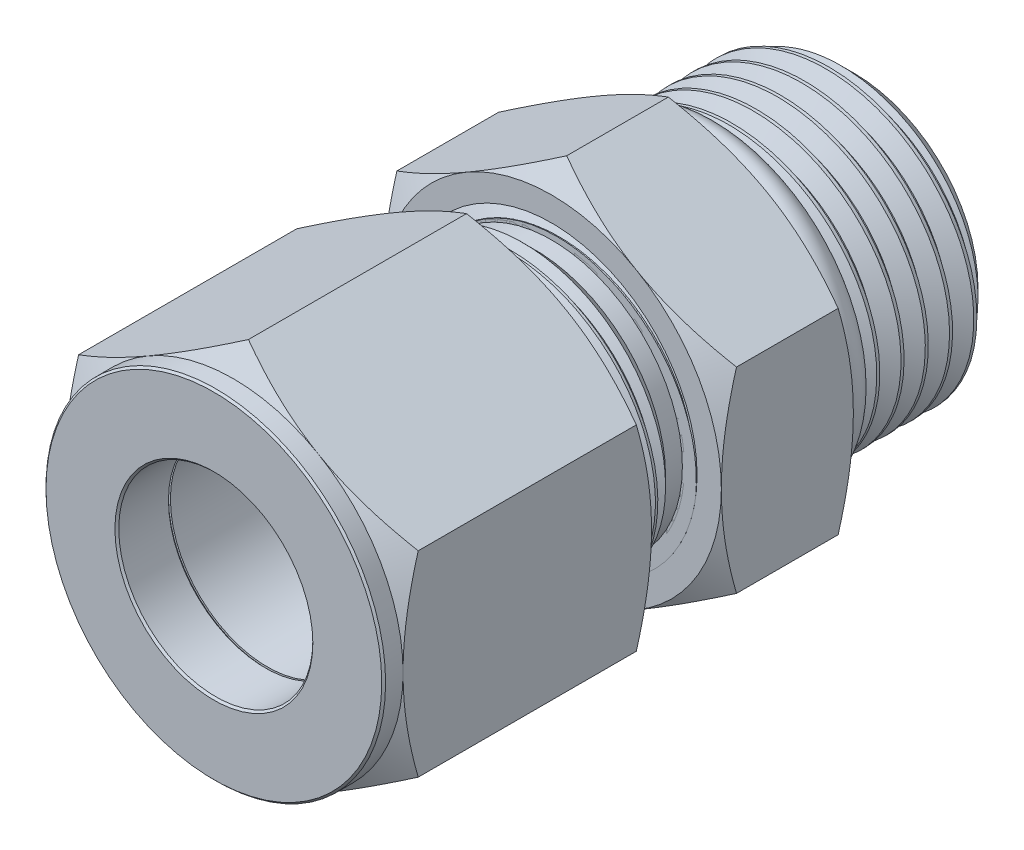
from build123d import *

# Parameters (mm, degrees)
BOSS_EXTRUDE1_DEPTH = 17.526
CHAMFER1_SIZE       = 0.127
SKETCH4_W           = 20.574
SKETCH4_H           = 9.525
BOSS_EXTRUDE2_DEPTH = 8.636
SKETCH11_W          = 11.176
SKETCH11_H          = 9.525
SKETCH15_R          = 1.1049
SKETCH17_OUTSIDE_W  = 160.102
SKETCH17_OUTSIDE_H  = 163.54
SKETCH17_OUTSIDE_R  = 11.1125
CUT_EXTRUDE1_DEPTH  = 36.110064377
CUT_EXTRUDE1_DRAFT  = -60
SKETCH18_OUTSIDE_W  = 135.004
SKETCH18_OUTSIDE_H  = 138.442
SKETCH18_OUTSIDE_R  = 11.1125
CUT_EXTRUDE2_DEPTH  = 28.865022314
CUT_EXTRUDE2_DRAFT  = -60
CHAMFER2_SIZE       = 1.42875
CUT_SWEEP1_PITCH    = 1.27
CUT_SWEEP2_PITCH    = 1.5875
SKETCH19_W          = 8.636
SKETCH19_H          = 0.824889197


with BuildPart() as part:
    # Sketch2 → Boss-Extrude1 (new body)
    with BuildSketch(Plane.XY):
        Polygon((0, 12.831609733), (-11.1125, 6.415804866), (-11.1125, -6.415804866), (0, -12.831609733), (11.1125, -6.415804866), (11.1125, 6.415804866), align=None)
    extrude(amount=-BOSS_EXTRUDE1_DEPTH)

    # Sketch3 → Cut-Revolve1 (revolve, cut)
    with BuildSketch(Plane(origin=(0, 0, 0), x_dir=(0, 0, -1), z_dir=(1, 0, 0)), mode=Mode.PRIVATE) as cut_revolve1_sk:
        Polygon((0, 12.831609733), (0, 11.1125), (1.27, 11.1125), (2.262528467, 12.831609733), (16.533471533, 12.831609733), (17.526, 11.1125), (17.526, 12.831609733), (17.526, 14.550719465), (0, 14.550719465), align=None)
        Polygon((0, 6.35), (0, 0), (17.526, 0), (17.526, 9.525), (7.0104, 9.525), (7.0104, 8.89), (3.5052, 8.89), (3.5052, 8.255), (3.5052, 6.35), align=None)
    revolve(cut_revolve1_sk.sketch.rotate(Axis((0, 0, 0), (0, 0, -1)), 90), axis=Axis((0, 0, 0), (0, 0, -1)), mode=Mode.SUBTRACT)

    # Chamfer1
    chamfer1_edges = [part.edges().sort_by_distance(p)[0] for p in [
        (-11.1125, 0, 0),
        (-6.35, 0, -3.5052),
        (-6.35, 0, 0),
    ]]
    chamfer(chamfer1_edges, length=CHAMFER1_SIZE)


with BuildPart() as body_2:
    # Sketch4 → Revolve1 (revolve)
    with BuildSketch(Plane(origin=(0, 0, 0), x_dir=(0, 0, -1), z_dir=(1, 0, 0)), mode=Mode.PRIVATE) as revolve1_sk:
        with Locations((20.447, 4.7625)):
            Rectangle(SKETCH4_W, SKETCH4_H)
    revolve(revolve1_sk.sketch.rotate(Axis((0, 0, -30.734), (0, 0, 1)), 90), axis=Axis((0, 0, -30.734), (0, 0, 1)))


with BuildPart() as body_3:
    # Sketch7 → Boss-Extrude2 (new body)
    with BuildSketch(Plane(origin=(0, 0, -30.734), x_dir=(-1, 0, 0), z_dir=(0, 0, -1))):
        Polygon((0, 12.831609733), (-11.1125, 6.415804866), (-11.1125, -6.415804866), (0, -12.831609733), (11.1125, -6.415804866), (11.1125, 6.415804866), align=None)
    extrude(amount=-BOSS_EXTRUDE2_DEPTH)


with BuildPart() as body_4:
    # Sketch9 → Revolve2 (revolve)
    with BuildSketch(Plane(origin=(0, 0, 0), x_dir=(0, 0, -1), z_dir=(1, 0, 0)), mode=Mode.PRIVATE) as revolve2_sk:
        Polygon((6.1976, 8.6614), (6.1976, 7.4676), (7.3152, 6.35), (13.5128, 6.35), (13.5128, 6.8834), align=None)
    revolve(revolve2_sk.sketch.rotate(Axis((0, 0, 0), (0, 0, -1)), 90), axis=Axis((0, 0, 0), (0, 0, -1)))


with BuildPart() as body_5:
    # Sketch10 → Revolve3 (revolve)
    with BuildSketch(Plane(origin=(0, 0, 0), x_dir=(0, 0, -1), z_dir=(1, 0, 0)), mode=Mode.PRIVATE) as revolve3_sk:
        Polygon((3.5052, 7.8359), (4.7752, 7.8359), (4.7752, 7.4676), (6.1976, 7.4676), (7.3152, 6.35), (3.5052, 6.35), align=None)
    revolve(revolve3_sk.sketch.rotate(Axis((0, 0, 0), (0, 0, -1)), 90), axis=Axis((0, 0, 0), (0, 0, -1)))


with BuildPart() as body_6:
    # Sketch11 → Revolve4 (revolve)
    with BuildSketch(Plane(origin=(0, 0, 0), x_dir=(0, 0, -1), z_dir=(1, 0, 0)), mode=Mode.PRIVATE) as revolve4_sk:
        with Locations((36.322, 4.7625)):
            Rectangle(SKETCH11_W, SKETCH11_H)
    revolve(revolve4_sk.sketch.rotate(Axis((0, 0, -30.734), (0, 0, -1)), 90), axis=Axis((0, 0, -30.734), (0, 0, -1)))


with BuildPart() as body_7:
    # Sketch15 → Revolve5 (revolve)
    with BuildSketch(Plane(origin=(0, 0, 0), x_dir=(0, 0, -1), z_dir=(1, 0, 0)), mode=Mode.PRIVATE) as revolve5_sk:
        with Locations((31.8389, 9.2837)):
            Circle(SKETCH15_R)
    revolve(revolve5_sk.sketch.rotate(Axis((0, 0, 0), (0, 0, -1)), 270), axis=Axis((0, 0, 0), (0, 0, -1)))


with BuildPart() as cut_extrude1_tool:
    # Sketch17 outside → Cut-Extrude1 (with draft: the straight prism first)
    with BuildSketch(Plane(origin=(0, 0, -30.734), x_dir=(-1, 0, 0), z_dir=(0, 0, -1))):
        Rectangle(SKETCH17_OUTSIDE_W, SKETCH17_OUTSIDE_H)
        with Locations(Location((0, 0, 0), (0, 0, 180))):
            Circle(SKETCH17_OUTSIDE_R, mode=Mode.SUBTRACT)
    extrude(amount=-CUT_EXTRUDE1_DEPTH)
    # Cut-Extrude1: the draft: its side faces are tilted about the plane it starts from
    cut_extrude1_sides = [cut_extrude1_tool.faces().sort_by_distance(p)[0] for p in [
        (0, -81.77, -12.678967811),
        (-80.051, 0, -12.678967811),
        (0, 81.77, -12.678967811),
        (80.051, 0, -12.678967811),
        (-11.1125, 0, -12.678967811),
    ]]
    draft(cut_extrude1_sides, Plane(origin=(0, 0, -30.734), x_dir=(-1, 0, 0), z_dir=(0, 0, -1)), CUT_EXTRUDE1_DRAFT)


with BuildPart() as body_3_1:
    add(body_3.part)

    # Cut-Extrude1: cut by cut_extrude1_tool
    add(cut_extrude1_tool.part, mode=Mode.SUBTRACT)


with BuildPart() as cut_extrude2_tool:
    # Sketch18 outside → Cut-Extrude2 (with draft: the straight prism first)
    with BuildSketch(Plane.XY.offset(-22.098)):
        Rectangle(SKETCH18_OUTSIDE_W, SKETCH18_OUTSIDE_H)
        Circle(SKETCH18_OUTSIDE_R, mode=Mode.SUBTRACT)
    extrude(amount=-CUT_EXTRUDE2_DEPTH)
    # Cut-Extrude2: the draft: its side faces are tilted about the plane it starts from
    cut_extrude2_sides = [cut_extrude2_tool.faces().sort_by_distance(p)[0] for p in [
        (0, -69.221, -36.530511157),
        (67.502, 0, -36.530511157),
        (0, 69.221, -36.530511157),
        (-67.502, 0, -36.530511157),
        (-11.1125, 0, -36.530511157),
    ]]
    draft(cut_extrude2_sides, Plane.XY.offset(-22.098), CUT_EXTRUDE2_DRAFT)


with BuildPart() as body_3_2:
    add(body_3_1.part)

    # Cut-Extrude2: cut by cut_extrude2_tool
    add(cut_extrude2_tool.part, mode=Mode.SUBTRACT)


with BuildPart() as cut_revolve5_tool:
    # Sketch16 → Cut-Revolve5 (revolve)
    with BuildSketch(Plane(origin=(0, 0, 0), x_dir=(0, 0, -1), z_dir=(1, 0, 0))):
        Polygon((41.91, 0), (10.16, 0), (10.16, 7.698316667), (15.70736, 6.35), (22.86, 6.35), (22.86, 5.1562), (41.91, 5.1562), (43.4975, 5.1562), (43.4975, 0), align=None)
    revolve(axis=Axis((0, 0, -41.91), (0, 0, 1)))


with BuildPart() as body_3_3:
    add(body_3_2.part)

    # Cut-Revolve5: cut by cut_revolve5_tool
    add(cut_revolve5_tool.part, mode=Mode.SUBTRACT)

    # Sketch19 → Cut-Revolve7 (revolve, cut)
    with BuildSketch(Plane(origin=(0, 0, 0), x_dir=(0, 0, -1), z_dir=(1, 0, 0)), mode=Mode.PRIVATE) as cut_revolve7_sk:
        with Locations((26.416, 9.112555401)):
            Rectangle(SKETCH19_W, SKETCH19_H)
    revolve(cut_revolve7_sk.sketch.rotate(Axis((0, 0, 0), (0, 0, -1)), 90), axis=Axis((0, 0, 0), (0, 0, -1)), mode=Mode.SUBTRACT)


with BuildPart() as body_2_1:
    add(body_2.part)

    # Cut-Revolve5: cut by cut_revolve5_tool
    add(cut_revolve5_tool.part, mode=Mode.SUBTRACT)

    # Cut-Sweep1: the profile of Sketch6 screwed along a right-hand helix of 17.2 turns, 8 arcs to a turn; built about Z, then put on its axis
    cut_sweep1_z = Axis((0, 0, 0), (0, 0, 1))
    cut_sweep1_corners = [(8.700110803, 0, -0.635), (9.593740766, 0, -1.1509375), (9.593740766, 0, 0.0396875), (8.700110803, 0, -0.47625)]
    with BuildLine(mode=Mode.PRIVATE) as cut_sweep1_profile:
        Line(cut_sweep1_corners[0], cut_sweep1_corners[1])
        Line(cut_sweep1_corners[1], cut_sweep1_corners[2])
        Line(cut_sweep1_corners[2], cut_sweep1_corners[3])
        Line(cut_sweep1_corners[3], cut_sweep1_corners[0])
    cut_sweep1_cap = Face(cut_sweep1_profile.wire())
    cut_sweep1_turn_angles = [0, 22.5, 45, 67.5, 90, 112.5, 135, 157.5, 180, 202.5, 225, 247.5, 270, 292.5, 315, 337.5, 360]
    cut_sweep1_turn_weights = [1, 0.9238795325112867, 1, 0.9238795325112867, 1, 0.9238795325112867, 1, 0.9238795325112867, 1, 0.9238795325112867, 1, 0.9238795325112867, 1, 0.9238795325112867, 1, 0.9238795325112867, 1]
    cut_sweep1_turn_rails = [Edge.make_bspline([Vector(p[0], p[1], 0).rotate(cut_sweep1_z, cut_sweep1_turn_angles[k]) / cut_sweep1_turn_weights[k] + Vector(0, 0, p[2] + CUT_SWEEP1_PITCH * cut_sweep1_turn_angles[k] / 360) for k in range(17)], [0, 0, 0, 1, 1, 2, 2, 3, 3, 4, 4, 5, 5, 6, 6, 7, 7, 8, 8, 8], 2, cut_sweep1_turn_weights) for p in cut_sweep1_corners]
    cut_sweep1_turn_sides = [Face.make_surface_from_curves(cut_sweep1_turn_rails[p[0]], cut_sweep1_turn_rails[p[1]]) for p in [(0, 1), (1, 2), (2, 3), (3, 0)]]
    cut_sweep1_last_angles = [6120, 6142.5, 6165, 6178.5, 6192]
    cut_sweep1_last_weights = [1, 0.9238795325112867, 1, 0.9723699203977044, 1]
    cut_sweep1_last_rails = [Edge.make_bspline([Vector(p[0], p[1], 0).rotate(cut_sweep1_z, cut_sweep1_last_angles[k]) / cut_sweep1_last_weights[k] + Vector(0, 0, p[2] + CUT_SWEEP1_PITCH * cut_sweep1_last_angles[k] / 360) for k in range(5)], [0, 0, 0, 1, 1, 2, 2, 2], 2, cut_sweep1_last_weights) for p in cut_sweep1_corners]
    cut_sweep1_last_sides = [Face.make_surface_from_curves(cut_sweep1_last_rails[p[0]], cut_sweep1_last_rails[p[1]]) for p in [(0, 1), (1, 2), (2, 3), (3, 0)]]
    cut_sweep1 = Plane(origin=(0, 0, -10.16), x_dir=(0, 1, 0), z_dir=(0, 0, -1)) * Solid(Shell([*[p.moved(Location((0, 0, CUT_SWEEP1_PITCH * i))) for i in range(17) for p in cut_sweep1_turn_sides], *cut_sweep1_last_sides, cut_sweep1_cap, cut_sweep1_cap.rotate(cut_sweep1_z, 6192).moved(Location((0, 0, CUT_SWEEP1_PITCH * 6192 / 360)))]))
    add(cut_sweep1, mode=Mode.SUBTRACT)

    # Sketch8 → Cut-Revolve2 (revolve, cut)
    with BuildSketch(Plane(origin=(0, 0, 0), x_dir=(0, 0, -1), z_dir=(1, 0, 0)), mode=Mode.PRIVATE) as cut_revolve2_sk:
        Polygon((10.16, 9.662481533), (10.16, 8.56262927), (11.259852263, 9.662481533), align=None)
        Polygon((22.098, 9.662481533), (19.898295474, 9.662481533), (20.998147737, 8.56262927), (22.098, 8.56262927), align=None)
    revolve(cut_revolve2_sk.sketch.rotate(Axis((0, 0, 0), (0, 0, -1)), 90), axis=Axis((0, 0, 0), (0, 0, -1)), mode=Mode.SUBTRACT)


with BuildPart() as body_6_1:
    add(body_6.part)

    # Cut-Revolve5: cut by cut_revolve5_tool
    add(cut_revolve5_tool.part, mode=Mode.SUBTRACT)

    # Chamfer2
    chamfer2_edges = [body_6_1.edges().sort_by_distance(p)[0] for p in [
        (-9.525, 0, -41.91),
    ]]
    chamfer(chamfer2_edges, length=CHAMFER2_SIZE)

    # Cut-Sweep2: the profile of Sketch13 screwed along a right-hand helix of 8.04 turns, 8 arcs to a turn; built about Z, then put on its axis
    cut_sweep2_z = Axis((0, 0, 0), (0, 0, 1))
    cut_sweep2_corners = [(9.696851916, 0, 0.09921875), (9.610925958, 0, -1.438671875), (8.493888504, 0, -0.79375), (8.493888504, 0, -0.5953125)]
    with BuildLine(mode=Mode.PRIVATE) as cut_sweep2_profile:
        Line(cut_sweep2_corners[0], cut_sweep2_corners[1])
        Line(cut_sweep2_corners[1], cut_sweep2_corners[2])
        Line(cut_sweep2_corners[2], cut_sweep2_corners[3])
        Line(cut_sweep2_corners[3], cut_sweep2_corners[0])
    cut_sweep2_cap = Face(cut_sweep2_profile.wire())
    cut_sweep2_turn_angles = [0, 22.5, 45, 67.5, 90, 112.5, 135, 157.5, 180, 202.5, 225, 247.5, 270, 292.5, 315, 337.5, 360]
    cut_sweep2_turn_weights = [1, 0.9238795325112867, 1, 0.9238795325112867, 1, 0.9238795325112867, 1, 0.9238795325112867, 1, 0.9238795325112867, 1, 0.9238795325112867, 1, 0.9238795325112867, 1, 0.9238795325112867, 1]
    cut_sweep2_turn_rails = [Edge.make_bspline([Vector(p[0], p[1], 0).rotate(cut_sweep2_z, cut_sweep2_turn_angles[k]) / cut_sweep2_turn_weights[k] + Vector(0, 0, p[2] + CUT_SWEEP2_PITCH * cut_sweep2_turn_angles[k] / 360) for k in range(17)], [0, 0, 0, 1, 1, 2, 2, 3, 3, 4, 4, 5, 5, 6, 6, 7, 7, 8, 8, 8], 2, cut_sweep2_turn_weights) for p in cut_sweep2_corners]
    cut_sweep2_turn_sides = [Face.make_surface_from_curves(cut_sweep2_turn_rails[p[0]], cut_sweep2_turn_rails[p[1]]) for p in [(0, 1), (1, 2), (2, 3), (3, 0)]]
    cut_sweep2_last_angles = [2880, 2887.2, 2894.4]
    cut_sweep2_last_weights = [1, 0.9921147013144598, 1]
    cut_sweep2_last_rails = [Edge.make_bspline([Vector(p[0], p[1], 0).rotate(cut_sweep2_z, cut_sweep2_last_angles[k]) / cut_sweep2_last_weights[k] + Vector(0, 0, p[2] + CUT_SWEEP2_PITCH * cut_sweep2_last_angles[k] / 360) for k in range(3)], [0, 0, 0, 1, 1, 1], 2, cut_sweep2_last_weights) for p in cut_sweep2_corners]
    cut_sweep2_last_sides = [Face.make_surface_from_curves(cut_sweep2_last_rails[p[0]], cut_sweep2_last_rails[p[1]]) for p in [(0, 1), (1, 2), (2, 3), (3, 0)]]
    cut_sweep2 = Plane(origin=(0, 0, -43.18), x_dir=(0, 1, 0), z_dir=(0, 0, 1)) * Solid(Shell([*[p.moved(Location((0, 0, CUT_SWEEP2_PITCH * i))) for i in range(8) for p in cut_sweep2_turn_sides], *cut_sweep2_last_sides, cut_sweep2_cap, cut_sweep2_cap.rotate(cut_sweep2_z, 2894.4).moved(Location((0, 0, CUT_SWEEP2_PITCH * 2894.4 / 360)))]))
    add(cut_sweep2, mode=Mode.SUBTRACT)

    # Sketch14 → Cut-Revolve4 (revolve, cut)
    with BuildSketch(Plane(origin=(0, 0, 0), x_dir=(0, 0, -1), z_dir=(1, 0, 0)), mode=Mode.PRIVATE) as cut_revolve4_sk:
        Polygon((33.483630657, 9.696851916), (30.734, 9.696851916), (30.734, 8.322036588), (32.108815329, 8.322036588), align=None)
    revolve(cut_revolve4_sk.sketch.rotate(Axis((0, 0, 0), (0, 0, -1)), 273.48162949), axis=Axis((0, 0, 0), (0, 0, -1)), mode=Mode.SUBTRACT)


with BuildPart() as part_1:
    add(part.part)

    # Combine3: union body 5, body 4
    add(body_5.part)
    add(body_4.part)


with BuildPart() as cut_revolve7_piece_1:
    # of the separate pieces the step leaves, piece 1, a body of its own (cut_revolve7_pieces)
    add(body_3_3.part.solids().sort_by_distance((8.700110803, 0, -30.734))[0])


with BuildPart() as cut_revolve7_piece_2:
    # of the separate pieces the step leaves, piece 2, a body of its own (cut_revolve7_pieces)
    add(body_3_3.part.solids().sort_by_distance((0, 12.831609733, -29.741471533))[0])


solid = Compound([body_7.part, body_2_1.part, body_6_1.part, part_1.part, cut_revolve7_piece_1.part, cut_revolve7_piece_2.part])
